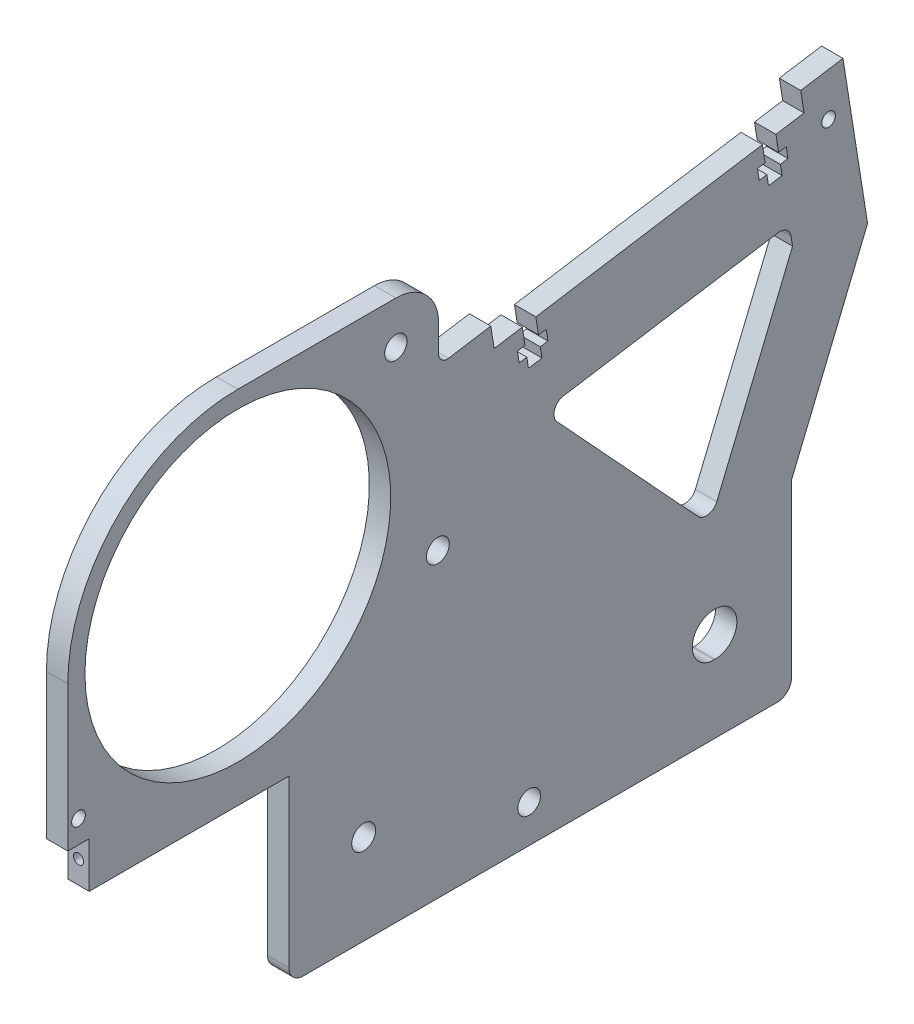
from build123d import *

# Parameters (mm, degrees)
SKETCH1_R           = 1.524
SKETCH1_R_2         = 2.667
SKETCH1_R_3         = 34.04
SKETCH1_R_4         = 2.54
SKETCH1_R_5         = 2.4892
BOSS_EXTRUDE1_DEPTH = 4.7625
SKETCH2_R           = 1.1303
CUT_EXTRUDE1_DEPTH  = 6.35


with BuildPart() as part:
    # Sketch1 → Boss-Extrude1 (new body)
    with BuildSketch(Plane(origin=(0, 0, 0), x_dir=(0, 0, -1), z_dir=(1, 0, 0))):
        with BuildLine():
            Line((-28.170295117, 0), (77.382795117, 0))
            ThreePointArc((77.382795117, 0), (79.627859148, 0.92993597), (80.557795117, 3.175))
            Line((80.557795117, 3.175), (80.557795117, 38.504743526))
            Line((80.557795117, 38.504743526), (80.557795117, 41.307035595))
            Line((80.557795117, 41.307035595), (97.47645297, 82.259613252))
            Line((97.47645297, 82.259613252), (92.000706017, 116.832118869))
            Line((92.000706017, 116.832118869), (82.592974573, 115.342080589))
            Line((82.592974573, 115.342080589), (83.337993713, 110.638214867))
            Line((83.337993713, 110.638214867), (77.06617275, 109.644856014))
            Line((77.06617275, 109.644856014), (77.667154856, 105.850404332))
            Line((77.667154856, 105.850404332), (79.360546516, 106.118611222))
            Line((79.360546516, 106.118611222), (79.752923263, 103.641241942))
            Line((79.752923263, 103.641241942), (78.059531603, 103.373035051))
            Line((78.059531603, 103.373035051), (78.432041173, 101.02110219))
            Line((78.432041173, 101.02110219), (75.421567111, 100.544289941))
            Line((75.421567111, 100.544289941), (75.049057541, 102.896222802))
            Line((75.049057541, 102.896222802), (73.355665881, 102.628015911))
            Line((73.355665881, 102.628015911), (72.963289134, 105.105385192))
            Line((72.963289134, 105.105385192), (74.656680794, 105.373592082))
            Line((74.656680794, 105.373592082), (74.055698688, 109.168043765))
            Line((74.055698688, 109.168043765), (23.630258147, 101.181438586))
            Line((23.630258147, 101.181438586), (24.231240253, 97.386986904))
            Line((24.231240253, 97.386986904), (25.924631913, 97.655193794))
            Line((25.924631913, 97.655193794), (26.31700866, 95.177824514))
            Line((26.31700866, 95.177824514), (24.623617, 94.909617624))
            Line((24.623617, 94.909617624), (24.99612657, 92.557684763))
            Line((24.99612657, 92.557684763), (21.985652508, 92.080872513))
            Line((21.985652508, 92.080872513), (21.613142938, 94.432805374))
            Line((21.613142938, 94.432805374), (19.919751278, 94.164598484))
            Line((19.919751278, 94.164598484), (19.527374531, 96.641967764))
            Line((19.527374531, 96.641967764), (21.220766191, 96.910174654))
            Line((21.220766191, 96.910174654), (20.619784085, 100.704626337))
            Line((20.619784085, 100.704626337), (14.347963122, 99.711267484))
            Line((14.347963122, 99.711267484), (13.602943983, 104.415133206))
            Line((13.602943983, 104.415133206), (4.195212538, 102.925094927))
            ThreePointArc((4.195212538, 102.925094927), (2.66000635, 103.358067851), (1.992204883, 104.806641215))
            Line((1.992204883, 104.806641215), (1.992204883, 110.875))
            ThreePointArc((1.992204883, 110.875), (-0.797603027, 117.610192091), (-7.532795117, 120.4))
            Line((-7.532795117, 120.4), (-42.707795117, 120.4))
            ThreePointArc((-42.707795117, 120.4), (-69.471786785, 109.313991668), (-80.557795117, 82.55))
            Line((-80.557795117, 82.55), (-80.557795117, 50.292))
            Line((-80.557795117, 50.292), (-75.795295117, 50.292))
            Line((-75.795295117, 50.292), (-75.795295117, 40.132))
            Line((-75.795295117, 40.132), (-31.345295117, 40.132))
            Line((-31.345295117, 40.132), (-31.345295117, 3.175))
            ThreePointArc((-31.345295117, 3.175), (-30.415359148, 0.92993597), (-28.170295117, 0))
        make_face()
        with Locations((-78.176545117, 55.372)):
            Circle(SKETCH1_R, mode=Mode.SUBTRACT)
        with Locations((-14.692204883, 20.066)):
            Circle(SKETCH1_R_2, mode=Mode.SUBTRACT)
        with Locations((-42.707795117, 82.55)):
            Circle(SKETCH1_R_3, mode=Mode.SUBTRACT)
        with Locations((22.137795117, 8.382)):
            Circle(SKETCH1_R_4, mode=Mode.SUBTRACT)
        with Locations((1.817795117, 67.06)):
            Circle(SKETCH1_R_4, mode=Mode.SUBTRACT)
        with Locations((88.786878575, 106.679368285)):
            Circle(SKETCH1_R, mode=Mode.SUBTRACT)
        with Locations((-7.532795117, 110.875)):
            Circle(SKETCH1_R_5, mode=Mode.SUBTRACT)
        with BuildLine():
            Line((63.539795117, 15.2273), (63.285795117, 15.2273))
            ThreePointArc((63.285795117, 15.2273), (58.447095117, 20.066), (63.285795117, 24.9047))
            Line((63.285795117, 24.9047), (63.539795117, 24.9047))
            ThreePointArc((63.539795117, 24.9047), (68.378495117, 20.066), (63.539795117, 15.2273))
        make_face(mode=Mode.SUBTRACT)
        with BuildLine():
            Line((77.537520924, 90.432049584), (29.798497, 82.870930999))
            ThreePointArc((29.798497, 82.870930999), (27.796275371, 81.195081352), (28.32965855, 78.639134195))
            Line((28.32965855, 78.639134195), (59.69934146, 44.663967177))
            ThreePointArc((59.69934146, 44.663967177), (62.012477448, 43.886669197), (63.913077429, 45.417195238))
            Line((63.913077429, 45.417195238), (80.774519188, 86.231278073))
            Line((80.774519188, 86.231278073), (80.44359285, 88.320664741))
            ThreePointArc((80.44359285, 88.320664741), (79.427839006, 89.978224365), (77.537520924, 90.432049584))
        make_face(mode=Mode.SUBTRACT)
    extrude(amount=BOSS_EXTRUDE1_DEPTH)

    # Sketch2 → Cut-Extrude1 (cut)
    with BuildSketch(Plane.XY.offset(75.795295117)):
        with Locations((2.38125, 45.212)):
            Circle(SKETCH2_R)
    extrude(amount=-CUT_EXTRUDE1_DEPTH, mode=Mode.SUBTRACT)


solid = part.part
